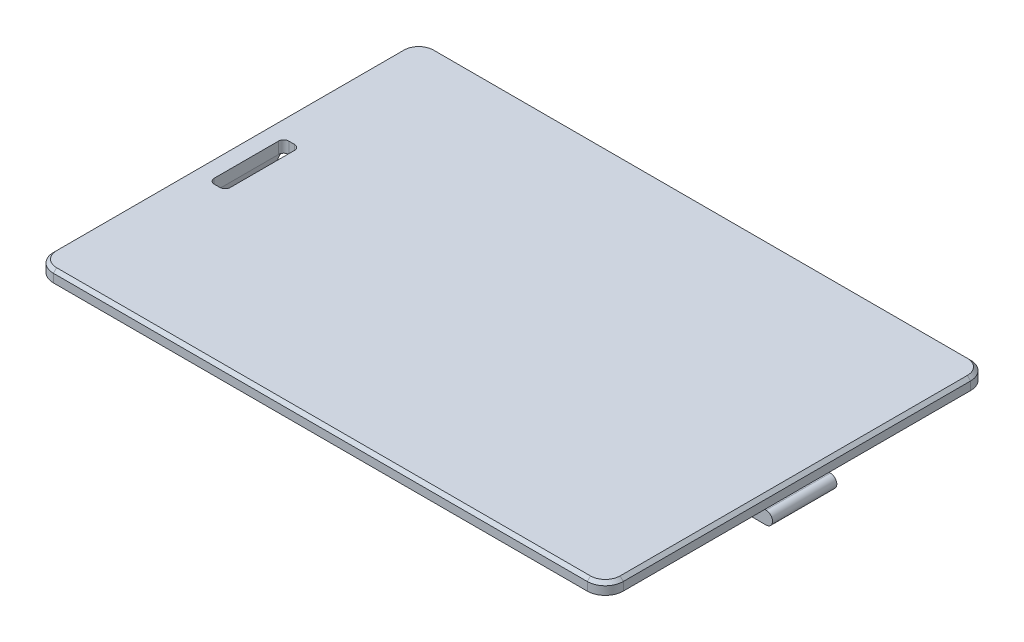
from build123d import *

# Parameters (mm, degrees)
SKIZZE1_W                       = 88.6
SKIZZE1_H                       = 59.6
AUFSATZ_LINEAR_AUSTRAGEN1_DEPTH = 1.8
SCHNITT_LINEAR_AUSTRAGEN1_DEPTH = 54.420688876
FASE1_SIZE                      = 0.5
AUFSATZ_LINEAR_AUSTRAGEN2_DEPTH = 5
AUFSATZ_LINEAR_AUSTRAGEN3_DEPTH = 5
VERRUNDUNG1_R                   = 0.8
SKIZZE5_W                       = 2.5
SKIZZE5_H                       = 11.6
SCHNITT_LINEAR_AUSTRAGEN2_DEPTH = 57.896671713
VERRUNDUNG2_R                   = 0.8


with BuildPart() as part:
    # Skizze1 → Aufsatz-Linear austragen1 (new body)
    with BuildSketch(Plane(origin=(0, 0, 0), x_dir=(1, 0, 0), z_dir=(0, 1, 0))):
        Rectangle(SKIZZE1_W, SKIZZE1_H)
    extrude(amount=AUFSATZ_LINEAR_AUSTRAGEN1_DEPTH)

    # Skizze2 → Schnitt-Linear austragen1 (cut, through all)
    with BuildSketch(Plane(origin=(0, 1.8, 0), x_dir=(1, 0, 0), z_dir=(0, 1, 0))):
        with BuildLine():
            Line((-44.3, -29.8), (-41.5, -29.8))
            ThreePointArc((-41.5, -29.8), (-43.479898987, -28.979898987), (-44.3, -27))
            Line((-44.3, -27), (-44.3, -29.8))
        make_face()
        with BuildLine():
            Line((41.5, -29.8), (44.3, -29.8))
            Line((44.3, -29.8), (44.3, -27))
            ThreePointArc((44.3, -27), (43.479898987, -28.979898987), (41.5, -29.8))
        make_face()
        with BuildLine():
            ThreePointArc((41.5, 29.8), (43.479898987, 28.979898987), (44.3, 27))
            Line((44.3, 27), (44.3, 29.8))
            Line((44.3, 29.8), (41.5, 29.8))
        make_face()
        with BuildLine():
            ThreePointArc((-44.3, 27), (-43.479898987, 28.979898987), (-41.5, 29.8))
            Line((-41.5, 29.8), (-44.3, 29.8))
            Line((-44.3, 29.8), (-44.3, 27))
        make_face()
    extrude(amount=-SCHNITT_LINEAR_AUSTRAGEN1_DEPTH, mode=Mode.SUBTRACT)

    # Fase1
    fase1_edges = [part.edges().sort_by_distance(p)[0] for p in [
        (44.3, 1.8, 0),
        (0, 1.8, -29.8),
        (-44.3, 1.8, 0),
        (0, 1.8, 29.8),
        (-43.479898987, 1.8, -28.979898987),
        (43.479898987, 1.8, -28.979898987),
        (43.479898987, 1.8, 28.979898987),
        (-43.479898987, 1.8, 28.979898987),
    ]]
    chamfer(fase1_edges, length=FASE1_SIZE)

    # Skizze3 → Aufsatz-Linear austragen2 (add, symmetric)
    with BuildSketch(Plane.XY):
        with BuildLine():
            Line((44.5, 0), (40.5, 0))
            ThreePointArc((40.5, 0), (41.207106781, -0.292893219), (41.5, -1))
            ThreePointArc((41.5, -1), (41.792893219, -1.707106781), (42.5, -2))
            Line((42.5, -2), (44.5, -2))
            ThreePointArc((44.5, -2), (45.5, -1), (44.5, 0))
        make_face()
    extrude(amount=AUFSATZ_LINEAR_AUSTRAGEN2_DEPTH, both=True)

    # Skizze4 → Aufsatz-Linear austragen3 (add, symmetric)
    with BuildSketch(Plane.XY):
        with BuildLine():
            Line((-44.3, 0), (-44.3, -8))
            Line((-44.3, -8), (-47, -8))
            Line((-47, -8), (-47, -9.5))
            Line((-47, -9.5), (-45, -11.5))
            ThreePointArc((-45, -11.5), (-43.963143632, -11.801551092), (-43.239596788, -11))
            Line((-43.239596788, -11), (-41.3, 0))
            Line((-41.3, 0), (-44.3, 0))
        make_face()
    extrude(amount=AUFSATZ_LINEAR_AUSTRAGEN3_DEPTH, both=True)

    # Verrundung1
    verrundung1_edges = [part.edges().sort_by_distance(p)[0] for p in [
        (-42.8, 0, -5),
        (-42.8, 0, 5),
    ]]
    fillet(verrundung1_edges, radius=VERRUNDUNG1_R)

    # Skizze5 → Schnitt-Linear austragen2 (cut, through all)
    with BuildSketch(Plane.XZ):
        with Locations((-40.05, 0)):
            Rectangle(SKIZZE5_W, SKIZZE5_H)
    extrude(amount=-SCHNITT_LINEAR_AUSTRAGEN2_DEPTH, mode=Mode.SUBTRACT)

    # Verrundung2
    # the kernel refuses this fillet: 0.8 mm, written as the material it adds along each edge
    with BuildSketch(Plane(origin=(-41.3, 0, -5.8), x_dir=(1, 0, 0), z_dir=(0, 1, 0))) as verrundung2_piece_1:
        with BuildLine():
            CenterArc((VERRUNDUNG2_R, -VERRUNDUNG2_R), VERRUNDUNG2_R, 90, 90)
            Line((0, -VERRUNDUNG2_R), (0, 0))
            Line((0, 0), (VERRUNDUNG2_R, 0))
        make_face()
    extrude(amount=1.8)
    with BuildSketch(Plane(origin=(-41.3, 0, 5.8), x_dir=(1, 0, 0), z_dir=(0, 1, 0)), Plane(origin=(-38.8, 0, 5.8), x_dir=(0, 0, -1), z_dir=(0, 1, 0)), Plane(origin=(-38.8, 0, -5.8), x_dir=(-1, 0, 0), z_dir=(0, 1, 0))) as verrundung2_piece_2:
        with BuildLine():
            CenterArc((VERRUNDUNG2_R, VERRUNDUNG2_R), VERRUNDUNG2_R, 180, 90)
            Line((0, VERRUNDUNG2_R), (0, 0))
            Line((0, 0), (VERRUNDUNG2_R, 0))
        make_face()
    extrude(amount=1.8)


solid = part.part
